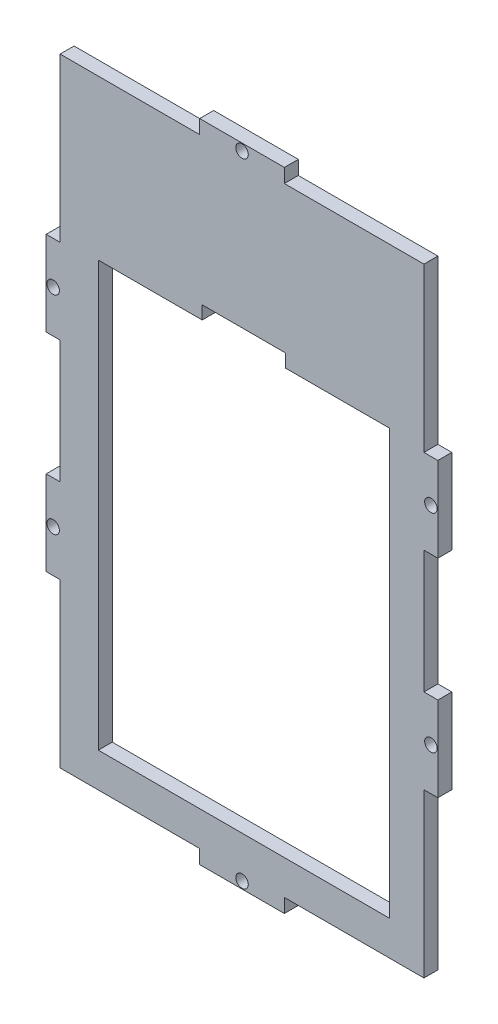
from build123d import *

# Parameters (mm, degrees)
BOSS_EXTRUDE1_DEPTH     = 3.18
CUT_EXTRUDE1_DEPTH      = 82.82160381
SKETCH27_W              = 3.18
SKETCH27_H              = 19.3
BOSS_EXTRUDE9_DEPTH     = 3.18
SKETCH28_W              = 19.3
SKETCH28_H              = 3.18
BOSS_EXTRUDE10_DEPTH    = 3.18
SKETCH29_R              = 1.425
CUT_EXTRUDE14_DEPTH     = 87.179315674
SKETCH30_R              = 1.425
CUT_EXTRUDE15_DEPTH     = 87.179315674
MIRROR9_COPY_1_SKETCH_W = 3.18
MIRROR9_COPY_1_SKETCH_H = 19.3
MIRROR9_COPY_1_DEPTH    = 3.18
MIRROR9_COPY_2_SKETCH_R = 1.425
MIRROR9_COPY_2_DEPTH    = 87.179315674
MIRROR9_COPY_3_SKETCH_W = 3.18
MIRROR9_COPY_3_SKETCH_H = 19.3
MIRROR9_COPY_3_DEPTH    = 3.18
MIRROR9_COPY_4_SKETCH_R = 1.425
MIRROR9_COPY_4_DEPTH    = 87.179315674


with BuildPart() as part:
    # Sketch1 → Boss-Extrude1 (new body)
    with BuildSketch(Plane.XY):
        Polygon((-41.465, 70.465), (-13.821666667, 70.465), (13.821666667, 70.465), (41.465, 70.465), (41.465, -70.465), (-41.465, -70.465), align=None)
    extrude(amount=BOSS_EXTRUDE1_DEPTH)

    # Sketch3 → Cut-Extrude1 (cut, through all)
    with BuildSketch(Plane(origin=(0, 0, 0), x_dir=(-1, 0, 0), z_dir=(0, 0, -1))):
        Polygon((-9.92174207, 34.15325793), (-33.59674207, 34.15325793), (-33.59674207, -62.59674207), (32.75325793, -62.59674207), (32.75325793, 34.15325793), (9.07825793, 34.15325793), (9.07825793, 37.15325793), (-9.92174207, 37.15325793), align=None)
    extrude(amount=-CUT_EXTRUDE1_DEPTH, mode=Mode.SUBTRACT)

    # Sketch27 → Boss-Extrude9 (add)
    with BuildSketch(Plane.ZY.offset(41.465)):
        with Locations((1.59, -23.645)):
            Rectangle(SKETCH27_W, SKETCH27_H)
    boss_extrude9 = extrude(amount=BOSS_EXTRUDE9_DEPTH)

    # Sketch28 → Boss-Extrude10 (add)
    with BuildSketch(Plane.XZ.offset(70.465)):
        with Locations((0, 1.59)):
            Rectangle(SKETCH28_W, SKETCH28_H)
    boss_extrude10 = extrude(amount=BOSS_EXTRUDE10_DEPTH)

    # Sketch29 → Cut-Extrude14 (cut, through all)
    with BuildSketch(Plane.XY.offset(3.18)):
        with Locations((-43.055, -23.645)):
            Circle(SKETCH29_R)
    cut_extrude14 = extrude(amount=-CUT_EXTRUDE14_DEPTH, mode=Mode.SUBTRACT)

    # Sketch30 → Cut-Extrude15 (cut, through all)
    with BuildSketch(Plane.XY.offset(3.18)):
        with Locations((0, -72.055)):
            Circle(SKETCH30_R)
    cut_extrude15 = extrude(amount=-CUT_EXTRUDE15_DEPTH, mode=Mode.SUBTRACT)

    # Mirror8: Boss-Extrude9, Cut-Extrude14 across plane
    add(boss_extrude9.mirror(Plane(origin=(0, 0, 0), x_dir=(0, 0, 1), z_dir=(1, 0, 0))))
    add(cut_extrude14.mirror(Plane(origin=(0, 0, 0), x_dir=(0, 0, 1), z_dir=(1, 0, 0))), mode=Mode.SUBTRACT)

    # Mirror9: Boss-Extrude10, Cut-Extrude15 across plane
    add(boss_extrude10.mirror(Plane.ZX))
    add(cut_extrude15.mirror(Plane.ZX), mode=Mode.SUBTRACT)

    # Mirror9 copy 1 sketch → Mirror9 copy 1 (add)
    with BuildSketch(Plane(origin=(41.465, 0, 0), x_dir=(0, 0, 1), z_dir=(1, 0, 0))):
        with Locations((1.59, -23.645)):
            Rectangle(MIRROR9_COPY_1_SKETCH_W, MIRROR9_COPY_1_SKETCH_H)
    extrude(amount=MIRROR9_COPY_1_DEPTH)

    # Mirror9 copy 2 sketch → Mirror9 copy 2 (cut, through all)
    with BuildSketch(Plane(origin=(0, 0, 3.18), x_dir=(-1, 0, 0), z_dir=(0, 0, 1))):
        with Locations((-43.055, -23.645)):
            Circle(MIRROR9_COPY_2_SKETCH_R)
    extrude(amount=-MIRROR9_COPY_2_DEPTH, mode=Mode.SUBTRACT)

    # Mirror9 copy 3 sketch → Mirror9 copy 3 (add)
    with BuildSketch(Plane.ZY.offset(41.465)):
        with Locations((1.59, 23.645)):
            Rectangle(MIRROR9_COPY_3_SKETCH_W, MIRROR9_COPY_3_SKETCH_H)
    extrude(amount=MIRROR9_COPY_3_DEPTH)

    # Mirror9 copy 4 sketch → Mirror9 copy 4 (cut, through all)
    with BuildSketch(Plane.XY.offset(3.18)):
        with Locations((-43.055, 23.645)):
            Circle(MIRROR9_COPY_4_SKETCH_R)
    extrude(amount=-MIRROR9_COPY_4_DEPTH, mode=Mode.SUBTRACT)


solid = part.part
